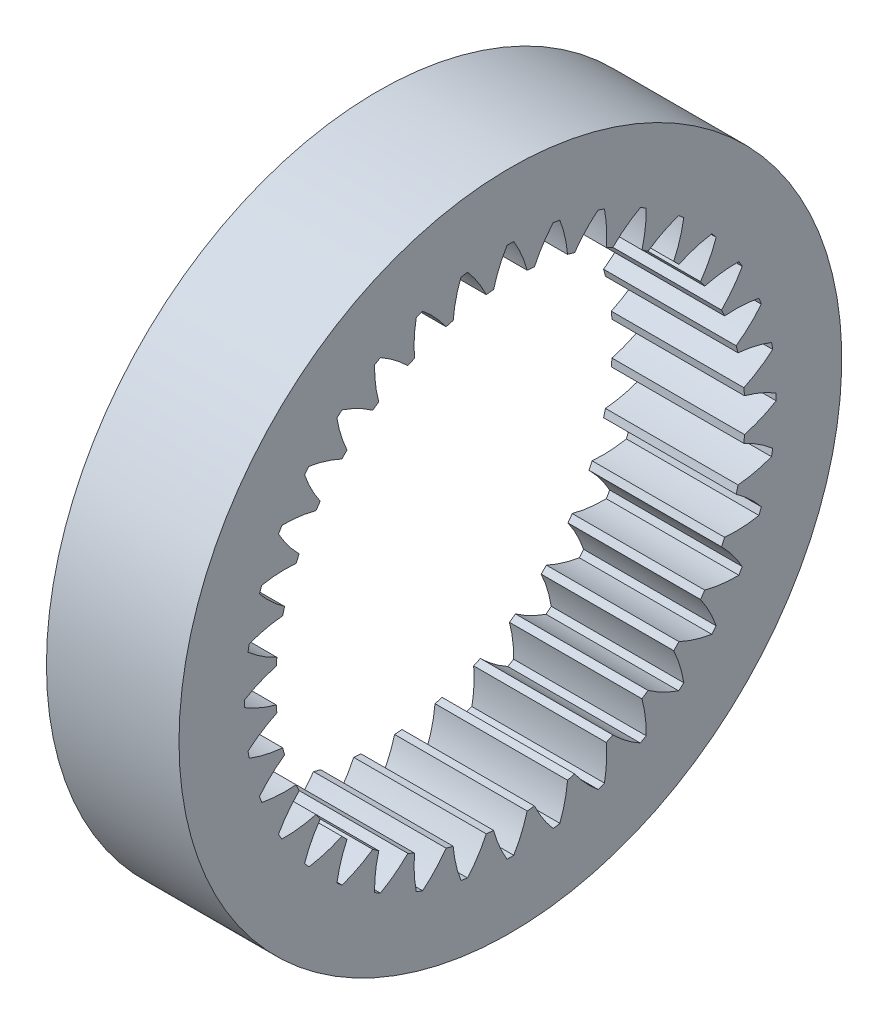
from build123d import *

# Parameters (mm, degrees)
BASPROSKE_W     = 12
BASPROSKE_H     = 8.75
TOOTHCUT_DEPTH  = 45.09081537
TEETHCUTS_COUNT = 36
TEETHCUTS_ANGLE = 350


with BuildPart() as part:
    # BasProSke → Base-Revolve (revolve)
    with BuildSketch(Plane(origin=(0, 0, 0), x_dir=(1, 0, 0), z_dir=(0, 1, 0))):
        with Locations((6, 25.625)):
            Rectangle(BASPROSKE_W, BASPROSKE_H)
    revolve(axis=Axis((-10, 0, 0), (1, 0, 0)))

    # TooCutSke → ToothCut (cut, through all)
    with BuildSketch(Plane(origin=(0, 0, 0), x_dir=(0, 0, -1), z_dir=(1, 0, 0))):
        with BuildLine():
            ThreePointArc((1.526741109, 21.169617539), (1.017792977, 22.658366355), (0.306126421, 24.061552711))
            ThreePointArc((0.306126421, 24.061552711), (0, 24.0635), (-0.306126421, 24.061552711))
            ThreePointArc((-0.306126421, 24.061552711), (-1.017792977, 22.658366355), (-1.526741109, 21.169617539))
            ThreePointArc((-1.526741109, 21.169617539), (0, 21.2246), (1.526741109, 21.169617539))
        make_face()
    toothcut = extrude(amount=TOOTHCUT_DEPTH, mode=Mode.SUBTRACT)

    # TeethCuts: ToothCut ×36 about axis
    teethcuts_axis = Axis((-10, 0, 0), (1, 0, 0))
    for i in range(1, TEETHCUTS_COUNT):
        add(toothcut.rotate(teethcuts_axis, i * TEETHCUTS_ANGLE / (TEETHCUTS_COUNT - 1)), mode=Mode.SUBTRACT)


solid = part.part
